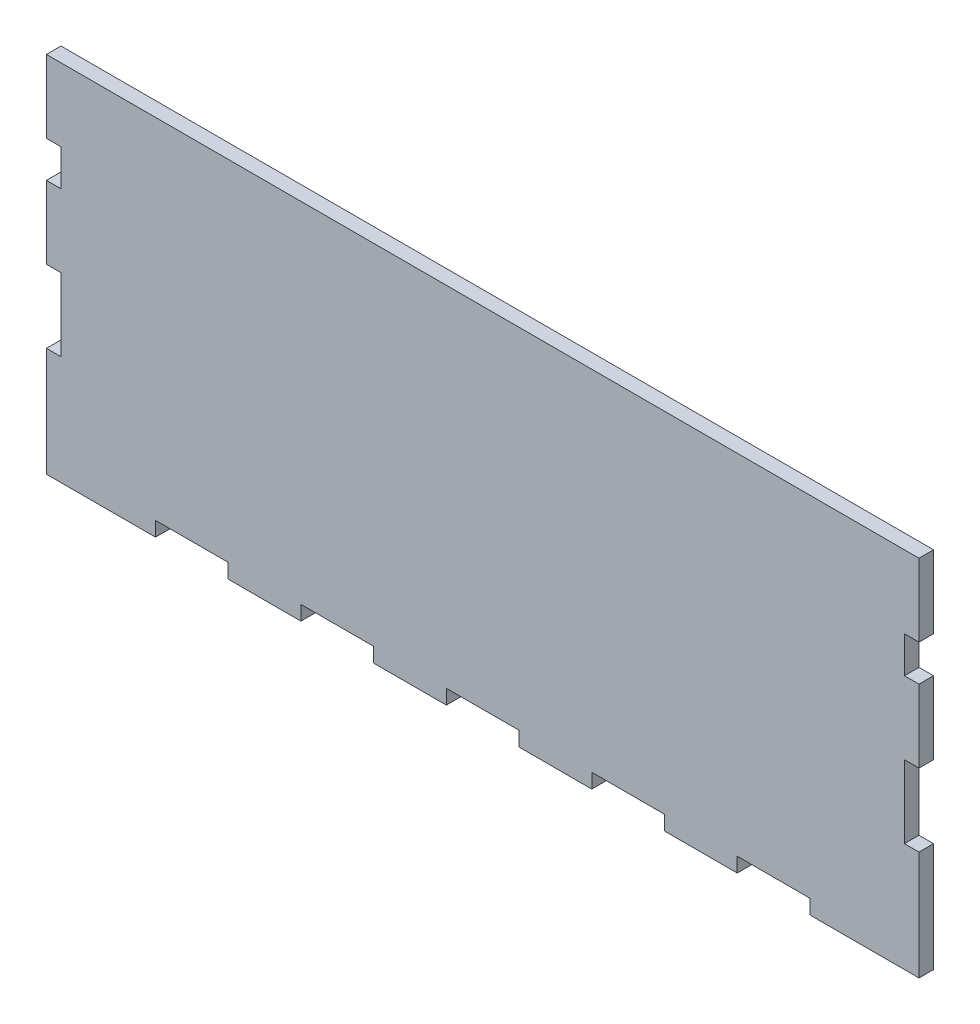
from build123d import *

# Parameters (mm, degrees)
BOSS_EXTRUDE1_DEPTH = 2.54


with BuildPart() as part:
    # Sketch1 → Boss-Extrude1 (new, symmetric)
    with BuildSketch(Plane.XY):
        Polygon((-152.4, 0), (-152.4, -25.4), (-147.32, -25.4), (-147.32, -38.1), (-152.4, -38.1), (-152.4, -63.5), (-147.32, -63.5), (-147.32, -88.9), (-152.4, -88.9), (-152.4, -127), (-114.3, -127), (-114.3, -121.92), (-88.9, -121.92), (-88.9, -127), (-63.5, -127), (-63.5, -121.92), (-38.1, -121.92), (-38.1, -127), (-12.7, -127), (-12.7, -121.92), (12.7, -121.92), (12.7, -127), (38.1, -127), (38.1, -121.92), (63.5, -121.92), (63.5, -127), (88.9, -127), (88.9, -121.92), (114.3, -121.92), (114.3, -127), (152.4, -127), (152.4, -88.9), (147.32, -88.9), (147.32, -63.5), (152.4, -63.5), (152.4, -38.1), (147.32, -38.1), (147.32, -25.4), (152.4, -25.4), (152.4, 0), align=None)
    extrude(amount=BOSS_EXTRUDE1_DEPTH, both=True)


solid = part.part
